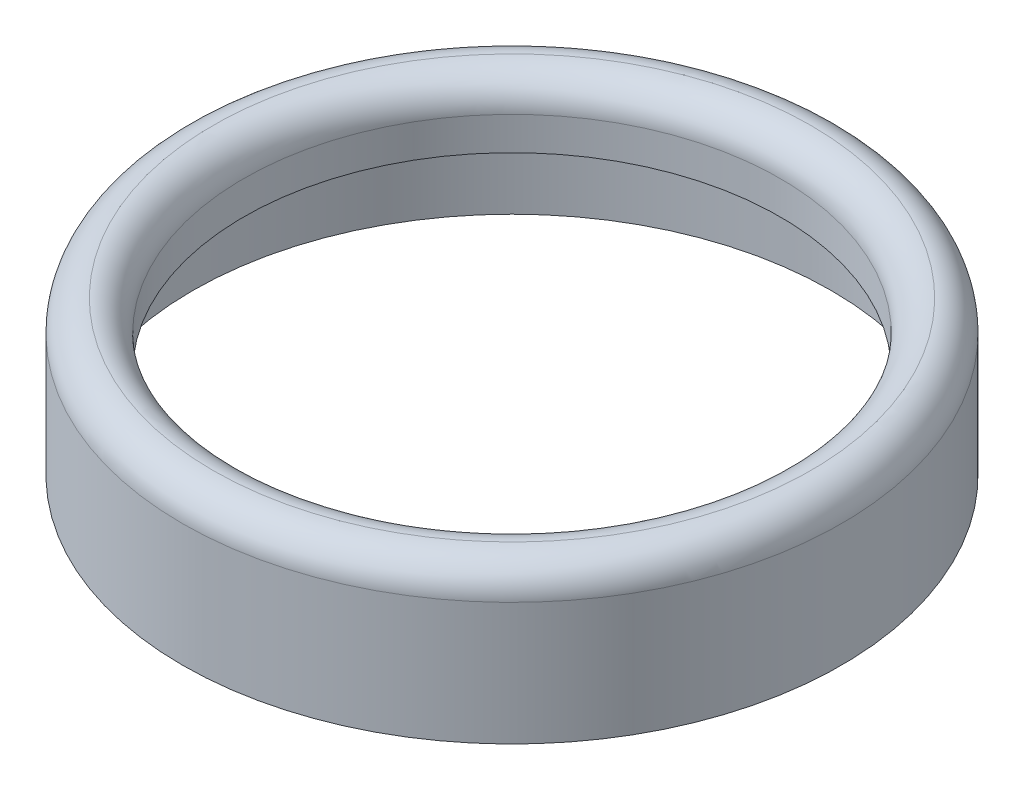
from build123d import *

# Parameters (mm, degrees)
SKETCH1_R           = 25.8
SKETCH1_R_2         = 25
BOSS_EXTRUDE1_DEPTH = 7
BOSS_EXTRUDE2_START = 5
SKETCH2_R           = 25.8
SKETCH2_R_2         = 21
BOSS_EXTRUDE2_DEPTH = 5
FILLET3_R           = 2.4


with BuildPart() as part:
    # Sketch1 → Boss-Extrude1 (new body)
    with BuildSketch(Plane(origin=(0, 0, 0), x_dir=(1, 0, 0), z_dir=(0, 1, 0))):
        with Locations(Location((0, 0, 0), (0, 0, 270))):
            Circle(SKETCH1_R)
        with Locations(Location((0, 0, 0), (0, 0, 270))):
            Circle(SKETCH1_R_2, mode=Mode.SUBTRACT)
    extrude(amount=-BOSS_EXTRUDE1_DEPTH)

    # Sketch2 → Boss-Extrude2 (add)
    with BuildSketch(Plane(origin=(0, 0, 0), x_dir=(1, 0, 0), z_dir=(0, 1, 0)).offset(BOSS_EXTRUDE2_START)):
        with Locations(Location((0, 0, 0), (0, 0, 270))):
            Circle(SKETCH2_R)
        with Locations(Location((0, 0, 0), (0, 0, 270))):
            Circle(SKETCH2_R_2, mode=Mode.SUBTRACT)
    extrude(amount=-BOSS_EXTRUDE2_DEPTH)

    # Fillet3
    fillet3_edges = [part.edges().sort_by_distance(p)[0] for p in [
        (0, 5, -25.8),
        (0, 5, -21),
    ]]
    fillet(fillet3_edges, radius=FILLET3_R - 0.0001)  # a hair under: the kernel refuses the full size


solid = part.part
